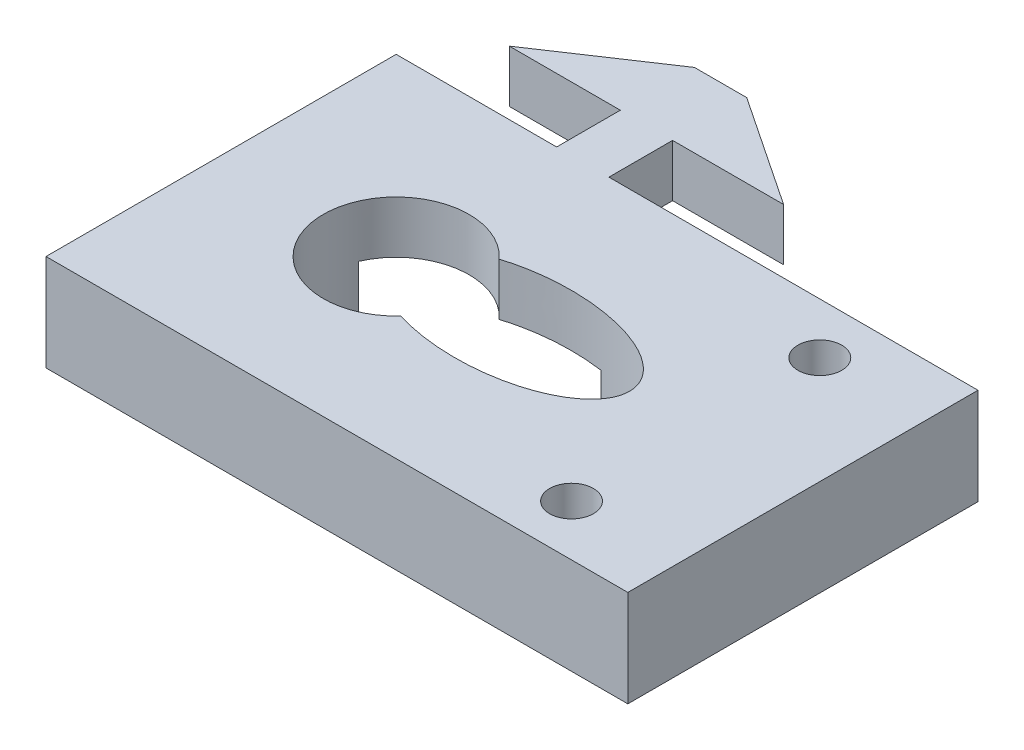
from build123d import *

# Parameters (mm, degrees)
BOSS_EXTRUDE1_DEPTH      = 3.5814
BOSS_EXTRUDE2_DEPTH      = 3.035
BOSS_EXTRUDE2_DEPTH_BACK = 3.035
SKETCH7_W                = 39.878
SKETCH7_H                = 24
CUT_EXTRUDE3_DEPTH       = 39.249964696
CUT_EXTRUDE3_DEPTH_BACK  = 39.249964696
SKETCH5_R                = 1.5
SKETCH8_W                = 18.796
SKETCH8_H                = 3.035
CUT_EXTRUDE4_DEPTH       = 10


with BuildPart() as part:
    # Sketch1 → Boss-Extrude1 (new body)
    with BuildSketch(Plane(origin=(0, 0, 0), x_dir=(1, 0, 0), z_dir=(0, 1, 0))):
        Polygon((-9.398, 2.1825), (-1.7907, 2.1825), (-1.7907, -2.1825), (-12.79, -2.1825), (-12.79, -26.1825), (27.088, -26.1825), (27.088, -2.1825), (1.7907, -2.1825), (1.7907, 2.1825), (9.398, 2.1825), (1.7907, 7.2625), (-1.7907, 7.2625), align=None)
    extrude(amount=BOSS_EXTRUDE1_DEPTH)

    # Sketch7 → Boss-Extrude2 (add, two sides: drawn at the far end of the back side and taken through both)
    with BuildSketch(Plane(origin=(0, 0, 0), x_dir=(1, 0, 0), z_dir=(0, 1, 0)).offset(-BOSS_EXTRUDE2_DEPTH_BACK)):
        with Locations((7.149, -14.1825)):
            Rectangle(SKETCH7_W, SKETCH7_H)
    extrude(amount=BOSS_EXTRUDE2_DEPTH + BOSS_EXTRUDE2_DEPTH_BACK)

    # Sketch5 → Cut-Extrude3 (cut, two sides: drawn at the far end of the back side and taken through both)
    with BuildSketch(Plane(origin=(0, 3.5814, 0), x_dir=(1, 0, 0), z_dir=(0, 1, 0)).offset(-CUT_EXTRUDE3_DEPTH_BACK)):
        with BuildLine():
            ThreePointArc((2.902928009, -10.811701472), (-5.79, -14.1825), (2.902928009, -17.553298528))
            add(Edge.make_bspline(
                [(2.902928009, -17.553298528), (15.21, -21.484670028), (15.21, -14.1825)],
                knots=[1.002278043, 1.002278043, 1.002278043, 3.141592654, 3.141592654, 3.141592654], degree=2, weights=[1, 0.480424813, 1]))
            add(Edge.make_bspline(
                [(15.21, -14.1825), (15.21, -6.880329972), (2.902928009, -10.811701472)],
                knots=[3.141592654, 3.141592654, 3.141592654, 5.280907265, 5.280907265, 5.280907265], degree=2, weights=[1, 0.480424813, 1]))
        make_face()
        with Locations((19.738, -22.6915)):
            Circle(SKETCH5_R)
        with Locations((19.738, -5.6735)):
            Circle(SKETCH5_R)
    extrude(amount=CUT_EXTRUDE3_DEPTH + CUT_EXTRUDE3_DEPTH_BACK, mode=Mode.SUBTRACT)

    # Sketch8 → Cut-Extrude4 (cut)
    with BuildSketch(Plane(origin=(0, 0, 2.1825), x_dir=(-1, 0, 0), z_dir=(0, 0, -1))):
        with Locations((0, -1.5175)):
            Rectangle(SKETCH8_W, SKETCH8_H)
    extrude(amount=-CUT_EXTRUDE4_DEPTH, mode=Mode.SUBTRACT)


solid = part.part
